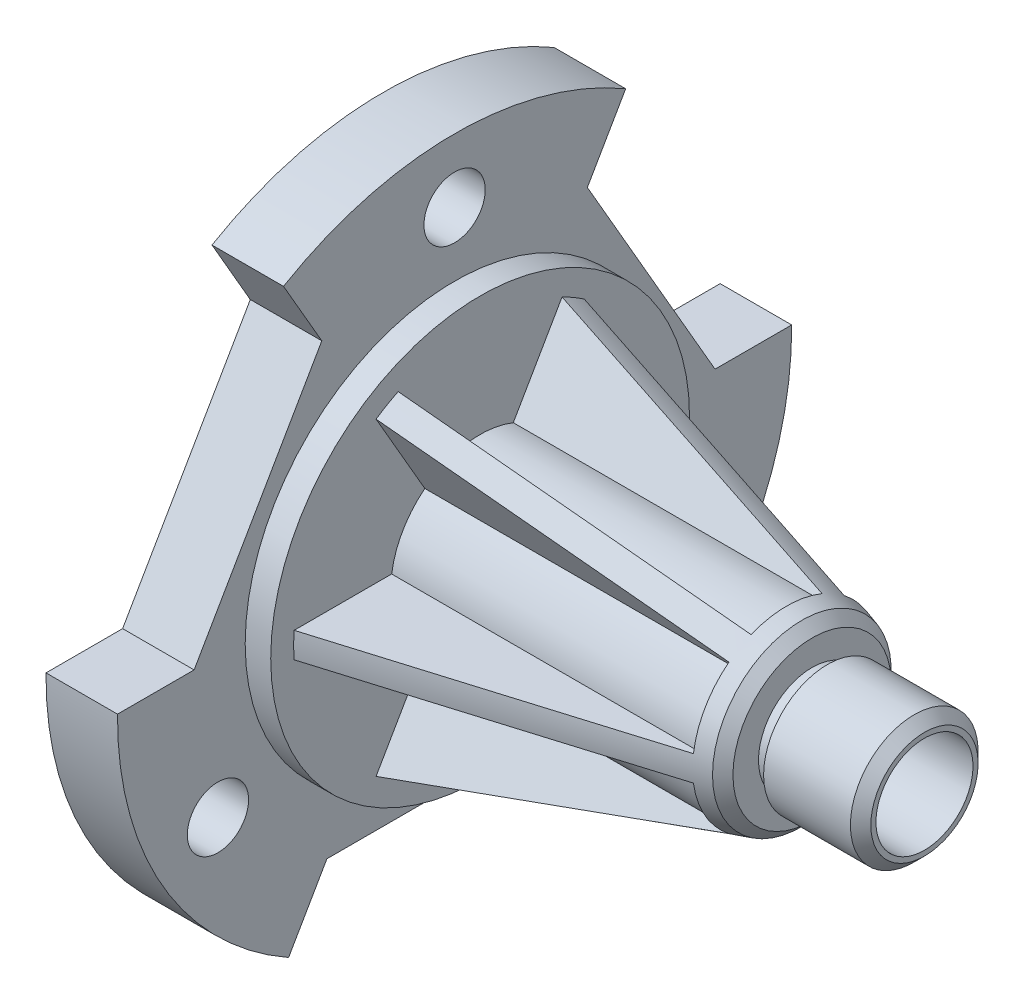
from build123d import *

# Parameters (mm, degrees)
SKETCH2_W           = 3
SKETCH2_H           = 2
CHAMFER1_SIZE       = 2
CUT_EXTRUDE1_DEPTH  = 132.057239403
CIRPATTERN1_COUNT   = 3
HOLE1_D             = 12
CIRPATTERN2_COUNT   = 3
CUT_EXTRUDE2_START  = -79
CUT_EXTRUDE2_DEPTH  = 79
BOSS_EXTRUDE2_START = -19
SKETCH9_R           = 41
BOSS_EXTRUDE2_DEPTH = 19
HOLE3_D             = 19
HOLE3_CBORE_D       = 44
HOLE3_CBORE_DEPTH   = 4


with BuildPart() as part:
    # Sketch1 → Revolve3 (revolve)
    with BuildSketch(Plane.XY, mode=Mode.PRIVATE) as revolve3_sk:
        Polygon((0, 0), (0, 66), (14, 66), (14, 41), (19, 41), (19, 17.5), (84, 17.5), (84, 12.5), (106, 12.5), (106, 0), align=None)
    revolve(revolve3_sk.sketch.rotate(Axis((0, 0, 0), (1, 0, 0)), 90), axis=Axis((0, 0, 0), (1, 0, 0)))

    # Sketch2 → Cut-Revolve1 (revolve, cut)
    with BuildSketch(Plane.XY, mode=Mode.PRIVATE) as cut_revolve1_sk:
        with Locations((85.5, 11.5)):
            Rectangle(SKETCH2_W, SKETCH2_H)
    revolve(cut_revolve1_sk.sketch.rotate(Axis((0, 0, 0), (1, 0, 0)), 90), axis=Axis((0, 0, 0), (1, 0, 0)), mode=Mode.SUBTRACT)

    # Sketch3 → Revolve5 (revolve)
    with BuildSketch(Plane(origin=(0, 0, 0), x_dir=(1, 0, 0), z_dir=(0, 1, 0)), mode=Mode.PRIVATE) as revolve5_sk:
        Polygon((19, 36.5), (82, 17.5), (19, 17.5), align=None)
    revolve(revolve5_sk.sketch.rotate(Axis((0, 0, 0), (1, 0, 0)), 180), axis=Axis((0, 0, 0), (1, 0, 0)))

    # Chamfer1
    chamfer1_edges = [part.edges().sort_by_distance(p)[0] for p in [
        (106, 0, -12.5),
        (84, 0, -17.5),
    ]]
    chamfer(chamfer1_edges, length=CHAMFER1_SIZE - 0.0001)  # a hair under: the kernel refuses the full size

    # Sketch4 → Cut-Extrude1 (cut, through all)
    with BuildSketch(Plane(origin=(14, 0, 0), x_dir=(0, 0, -1), z_dir=(1, 0, 0))):
        with BuildLine():
            Line((-32.5, -57.443450453), (-25, -44.453069397))
            Line((-25, -44.453069397), (25, -44.453069397))
            Line((25, -44.453069397), (32.5, -57.443450453))
            ThreePointArc((32.5, -57.443450453), (0, -66), (-32.5, -57.443450453))
        make_face()
    cut_extrude1 = extrude(amount=-CUT_EXTRUDE1_DEPTH, mode=Mode.SUBTRACT)

    # CirPattern1: Cut-Extrude1 ×3 about axis
    cirpattern1_axis = Axis((0, 0, 0), (1, 0, 0))
    for i in range(1, CIRPATTERN1_COUNT):
        add(cut_extrude1.rotate(cirpattern1_axis, i * 360 / CIRPATTERN1_COUNT), mode=Mode.SUBTRACT)

    # Hole1 (through all)
    with Locations(Plane(origin=(14, 0, 0), x_dir=(0, 0, -1), z_dir=(1, 0, 0))):
        with Locations((0, 53.5)):
            hole1 = Hole(HOLE1_D / 2)

    # CirPattern2: Hole1 ×3 about axis
    cirpattern2_axis = Axis((0, 0, 0), (1, 0, 0))
    for i in range(1, CIRPATTERN2_COUNT):
        add(hole1.rotate(cirpattern2_axis, i * 360 / CIRPATTERN2_COUNT), mode=Mode.SUBTRACT)

    # Sketch7 → Cut-Extrude2 (cut)
    with BuildSketch(Plane.ZY.offset(CUT_EXTRUDE2_START)):
        with BuildLine():
            Line((17.320508076, 2.5), (40.923709509, 2.5))
            ThreePointArc((40.923709509, 2.5), (35.507041555, 20.5), (22.626918264, 34.190972052))
            Line((22.626918264, 34.190972052), (10.825317547, 13.75))
            ThreePointArc((10.825317547, 13.75), (15.155444566, 8.75), (17.320508076, 2.5))
        make_face()
        with BuildLine():
            Line((17.320508076, -2.5), (40.923709509, -2.5))
            ThreePointArc((40.923709509, -2.5), (35.507041555, -20.5), (22.626918264, -34.190972052))
            Line((22.626918264, -34.190972052), (10.825317547, -13.75))
            ThreePointArc((10.825317547, -13.75), (15.155444566, -8.75), (17.320508076, -2.5))
        make_face()
        with BuildLine():
            Line((6.495190528, -16.25), (18.296791245, -36.690972052))
            ThreePointArc((18.296791245, -36.690972052), (0, -41), (-18.296791245, -36.690972052))
            Line((-18.296791245, -36.690972052), (-6.495190528, -16.25))
            ThreePointArc((-6.495190528, -16.25), (0, -17.5), (6.495190528, -16.25))
        make_face()
        with BuildLine():
            Line((-10.825317547, -13.75), (-22.626918264, -34.190972052))
            ThreePointArc((-22.626918264, -34.190972052), (-35.507041555, -20.5), (-40.923709509, -2.5))
            Line((-40.923709509, -2.5), (-17.320508076, -2.5))
            ThreePointArc((-17.320508076, -2.5), (-15.155444566, -8.75), (-10.825317547, -13.75))
        make_face()
        with BuildLine():
            Line((-17.320508076, 2.5), (-40.923709509, 2.5))
            ThreePointArc((-40.923709509, 2.5), (-35.507041555, 20.5), (-22.626918264, 34.190972052))
            Line((-22.626918264, 34.190972052), (-10.825317547, 13.75))
            ThreePointArc((-10.825317547, 13.75), (-15.155444566, 8.75), (-17.320508076, 2.5))
        make_face()
        with BuildLine():
            Line((-6.495190528, 16.25), (-18.296791245, 36.690972052))
            ThreePointArc((-18.296791245, 36.690972052), (0, 41), (18.296791245, 36.690972052))
            Line((18.296791245, 36.690972052), (6.495190528, 16.25))
            ThreePointArc((6.495190528, 16.25), (0, 17.5), (-6.495190528, 16.25))
        make_face()
    extrude(amount=CUT_EXTRUDE2_DEPTH, mode=Mode.SUBTRACT)

    # Sketch9 → Boss-Extrude2 (add)
    with BuildSketch(Plane.ZY.offset(BOSS_EXTRUDE2_START)):
        Circle(SKETCH9_R)
    extrude(amount=BOSS_EXTRUDE2_DEPTH)

    # Hole3 (through all)
    with Locations(Plane.ZY):
        with Locations((0, 0)):
            CounterBoreHole(HOLE3_D / 2, HOLE3_CBORE_D / 2, HOLE3_CBORE_DEPTH)


solid = part.part
